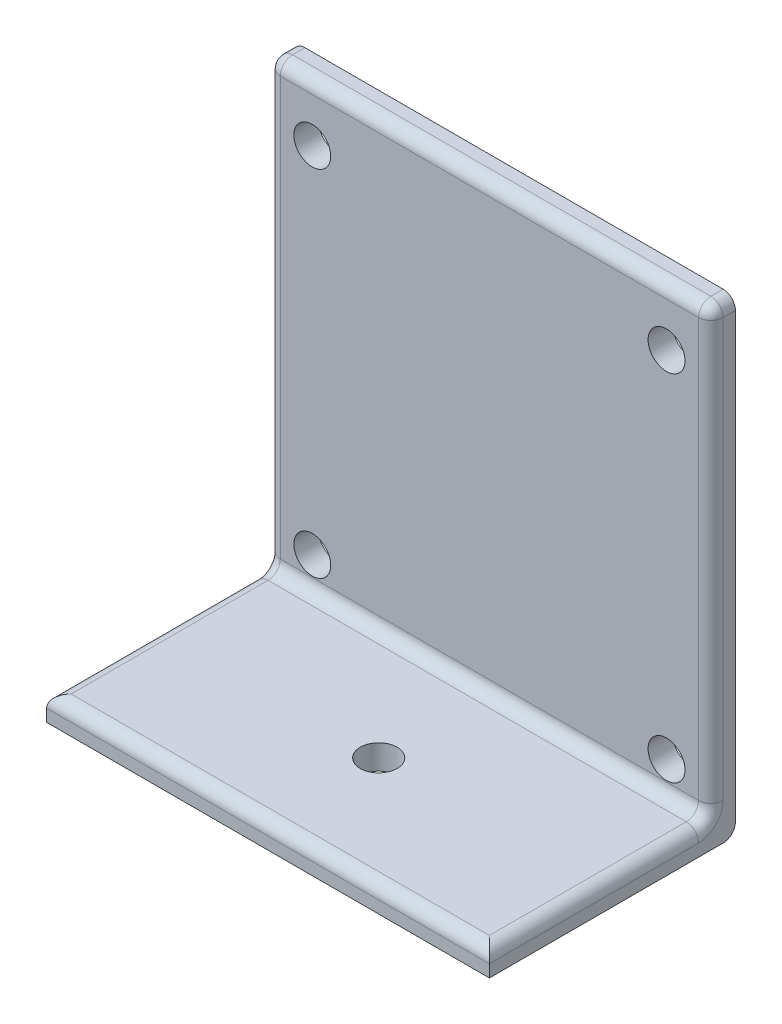
from build123d import *

# Parameters (mm, degrees)
SKETCH1_W           = 36
SKETCH1_H           = 20
BOSS_EXTRUDE1_DEPTH = 2
SKETCH2_W           = 36
SKETCH2_H           = 2
BOSS_EXTRUDE2_DEPTH = 36
CUT_EXTRUDE1_REACH  = 48.562
SKETCH3_R           = 1.5
CUT_EXTRUDE3_REACH  = 43.473
SKETCH4_R           = 1.5
FILLET1_R           = 1


with BuildPart() as part:
    # Sketch1 → Boss-Extrude1 (new body)
    with BuildSketch(Plane(origin=(0, 0, 0), x_dir=(1, 0, 0), z_dir=(0, 1, 0))):
        Rectangle(SKETCH1_W, SKETCH1_H)
    extrude(amount=BOSS_EXTRUDE1_DEPTH)

    # Sketch2 → Boss-Extrude2 (add)
    with BuildSketch(Plane(origin=(0, 2, 0), x_dir=(1, 0, 0), z_dir=(0, 1, 0))):
        with Locations((0, 9)):
            Rectangle(SKETCH2_W, SKETCH2_H)
    extrude(amount=BOSS_EXTRUDE2_DEPTH)

    # Sketch3 → Cut-Extrude1 (cut, up to next)
    with BuildSketch(Plane(origin=(0, 0, -10), x_dir=(-1, 0, 0), z_dir=(0, 0, -1)), mode=Mode.PRIVATE) as cut_extrude1_sk1:
        with Locations((-14.4, 33.4)):
            Circle(SKETCH3_R)
    cut_extrude1_tool1 = extrude(cut_extrude1_sk1.sketch, amount=-CUT_EXTRUDE1_REACH, mode=Mode.PRIVATE) & part.part
    # Sketch3 → Cut-Extrude1 (cut, up to next)
    with BuildSketch(Plane(origin=(0, 0, -10), x_dir=(-1, 0, 0), z_dir=(0, 0, -1)), mode=Mode.PRIVATE) as cut_extrude1_sk2:
        with Locations((14.4, 33.4)):
            Circle(SKETCH3_R)
    cut_extrude1_tool2 = extrude(cut_extrude1_sk2.sketch, amount=-CUT_EXTRUDE1_REACH, mode=Mode.PRIVATE) & part.part
    # Sketch3 → Cut-Extrude1 (cut, up to next)
    with BuildSketch(Plane(origin=(0, 0, -10), x_dir=(-1, 0, 0), z_dir=(0, 0, -1)), mode=Mode.PRIVATE) as cut_extrude1_sk3:
        with Locations((14.4, 4.6)):
            Circle(SKETCH3_R)
    cut_extrude1_tool3 = extrude(cut_extrude1_sk3.sketch, amount=-CUT_EXTRUDE1_REACH, mode=Mode.PRIVATE) & part.part
    # Sketch3 → Cut-Extrude1 (cut, up to next)
    with BuildSketch(Plane(origin=(0, 0, -10), x_dir=(-1, 0, 0), z_dir=(0, 0, -1)), mode=Mode.PRIVATE) as cut_extrude1_sk4:
        with Locations((-14.4, 4.6)):
            Circle(SKETCH3_R)
    cut_extrude1_tool4 = extrude(cut_extrude1_sk4.sketch, amount=-CUT_EXTRUDE1_REACH, mode=Mode.PRIVATE) & part.part
    add(cut_extrude1_tool1.solids().sort_by_distance((14.4, 33.4, -10))[0], mode=Mode.SUBTRACT)
    add(cut_extrude1_tool2.solids().sort_by_distance((-14.4, 33.4, -10))[0], mode=Mode.SUBTRACT)
    add(cut_extrude1_tool3.solids().sort_by_distance((-14.4, 4.6, -10))[0], mode=Mode.SUBTRACT)
    add(cut_extrude1_tool4.solids().sort_by_distance((14.4, 4.6, -10))[0], mode=Mode.SUBTRACT)

    # Sketch4 → Cut-Extrude3 (cut, up to next)
    with BuildSketch(Plane(origin=(0, 2, 0), x_dir=(1, 0, 0), z_dir=(0, 1, 0)), mode=Mode.PRIVATE) as cut_extrude3_sk1:
        with Locations((0, -1)):
            Circle(SKETCH4_R)
    cut_extrude3_tool1 = extrude(cut_extrude3_sk1.sketch, amount=-CUT_EXTRUDE3_REACH, mode=Mode.PRIVATE) & part.part
    add(cut_extrude3_tool1.solids().sort_by_distance((0, 2, 1))[0], mode=Mode.SUBTRACT)

    # Fillet1
    fillet1_edges = [part.edges().sort_by_distance(p)[0] for p in [
        (-18, 2, 1),
        (18, 2, 1),
        (0, 2, 10),
        (0, 2, -8),
        (18, 20, -8),
        (0, 38, -8),
        (-18, 20, -8),
        (0, 0, -10),
        (18, 38, -9),
        (-18, 38, -9),
    ]]
    fillet(fillet1_edges, radius=FILLET1_R)


solid = part.part
